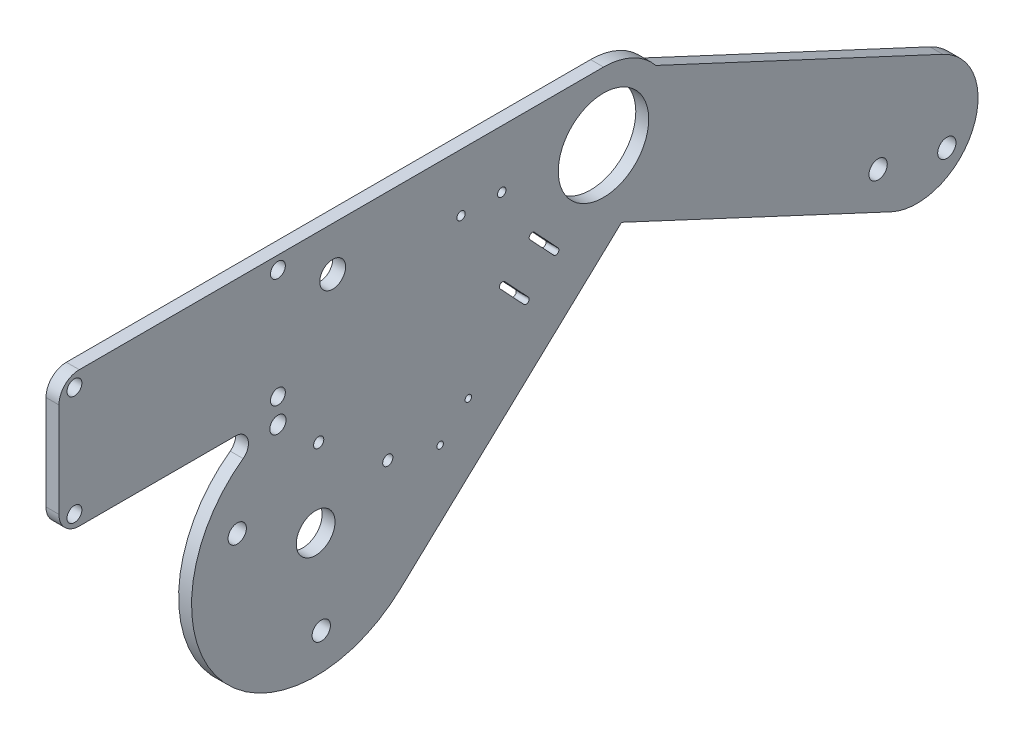
from build123d import *

# Parameters (mm, degrees)
SKETCH1_R                  = 4.7625
SKETCH1_R_2                = 11.1125
BOSS_EXTRUDE1_DEPTH        = 1.5875
SKETCH12_R                 = 11.1125
BOSS_EXTRUDE2_DEPTH        = 1.5875
F_6_CLEARANCE_HOLE1_D      = 3.6576
M3X0_5_TAPPED_HOLE1_D      = 2.5
M4_CLEARANCE_HOLE1_D       = 4.5
M2X0_4_TAPPED_HOLE1_D      = 1.6
FILLET1_R                  = 5
FILLET2_R                  = 3.175
CUT_EXTRUDE1_DEPTH         = 155.713872435
CUT_EXTRUDE1_DEPTH_BACK    = 155.713872435
SKETCH1_3_R                = 2
F_1_4_0_2500_DOWEL_HOLE1_D = 6.35
F_1_5MM_START              = -1.5875
F_1_5MM_DOWEL_SLOT1_DEPTH  = 3.175
M2_5X0_45_TAPPED_HOLE1_D   = 2.05


# Read off the part's stored shape, not the designer's step: Ø1.5mm Dowel Slot1
with BuildPart() as part:
    # Sketch1 → Boss-Extrude1 (new, symmetric)
    with BuildSketch(Plane(origin=(0, 0, 0), x_dir=(0, 0, -1), z_dir=(1, 0, 0))):
        with BuildLine():
            ThreePointArc((-83.281063832, -19.348369622), (-96.105900293, -64.061735294), (-49.900079745, -69.426774672))
            Line((-49.900079745, -69.426774672), (11.366191703, -12.160004571))
            ThreePointArc((11.366191703, -12.160004571), (15.483205435, 6.109531443), (0, 16.645))
            Line((0, 16.645), (-133.81, 16.645))
            Line((-133.81, 16.645), (-133.81, -16.645))
            Line((-133.81, -16.645), (-77.295250897, -16.645))
            Line((-77.295250897, -16.645), (-83.281063832, -19.348369622))
        make_face()
        with Locations((-70.72728593, -47.145)):
            Circle(SKETCH1_R, mode=Mode.SUBTRACT)
        Circle(SKETCH1_R_2, mode=Mode.SUBTRACT)
    extrude(amount=BOSS_EXTRUDE1_DEPTH, both=True)

    # Sketch12 → Boss-Extrude2 (add, symmetric)
    with BuildSketch(Plane(origin=(0, 0, 0), x_dir=(0, 0, -1), z_dir=(1, 0, 0))):
        with BuildLine():
            Line((83.375435824, -22.327935442), (6.339273926, 13.594616806))
            ThreePointArc((6.339273926, 13.594616806), (-13.594616806, 6.339273926), (-6.339273926, -13.594616806))
            Line((-6.339273926, -13.594616806), (70.696887972, -49.517169054))
            ThreePointArc((70.696887972, -49.517169054), (90.630778704, -42.261826174), (83.375435824, -22.327935442))
        make_face()
        Circle(SKETCH12_R, mode=Mode.SUBTRACT)
    extrude(amount=BOSS_EXTRUDE2_DEPTH, both=True)

    # #6 Clearance Hole1 (through all)
    with Locations(Plane(origin=(1.5875, 0, 0), x_dir=(0, 0, -1), z_dir=(1, 0, 0))):
        with Locations((-80, -13.475), (-80, 13.475), (-130, 13.475), (-130, -13.475)):
            Hole(F_6_CLEARANCE_HOLE1_D / 2)

    # M3x0.5 Tapped Hole1 (through all)
    with Locations(Plane(origin=(1.5875, 0, 0), x_dir=(0, 0, -1), z_dir=(1, 0, 0))):
        with Locations((-53.003557214, -40.529688942), (-69.983650742, -28.241563627)):
            Hole(M3X0_5_TAPPED_HOLE1_D / 2)

    # M4 Clearance Hole1 (through all)
    with Locations(Plane(origin=(1.5875, 0, 0), x_dir=(0, 0, -1), z_dir=(1, 0, 0))):
        with Locations((84.362778856, -42.728482305), (-69.34493086, -68.600514314), (-89.999483912, -37.614397451), (67.478745093, -38.864623629)):
            Hole(M4_CLEARANCE_HOLE1_D / 2)

    # M2x0.4 Tapped Hole1 (through all)
    with Locations(Plane(origin=(1.5875, 0, 0), x_dir=(0, 0, -1), z_dir=(1, 0, 0))):
        with Locations((-33.212044815, -37.265281486), (-40.152269713, -43.752444068)):
            Hole(M2X0_4_TAPPED_HOLE1_D / 2)

    # Fillet1
    fillet1_edges = [part.edges().sort_by_distance(p)[0] for p in [
        (0, -16.645, 133.81),
        (0, 16.645, 133.81),
    ]]
    fillet(fillet1_edges, radius=FILLET1_R)

    # Fillet2
    fillet2_edges = [part.edges().sort_by_distance(p)[0] for p in [
        (0, -16.645, 77.295250897),
    ]]
    fillet(fillet2_edges, radius=FILLET2_R)

    # Sketch1<3> → Cut-Extrude1 (cut, two sides: drawn at the far end of the back side and taken through both)
    with BuildSketch(Plane(origin=(0, 0, 0), x_dir=(0, 0, -1), z_dir=(1, 0, 0)).offset(-CUT_EXTRUDE1_DEPTH_BACK)):
        with Locations((-80, -19.435)):
            Circle(SKETCH1_3_R)
    extrude(amount=CUT_EXTRUDE1_DEPTH + CUT_EXTRUDE1_DEPTH_BACK, mode=Mode.SUBTRACT)

    # 1/4 (0.2500) Dowel Hole1 (through all)
    with Locations(Plane(origin=(1.5875, 0, 0), x_dir=(0, 0, -1), z_dir=(1, 0, 0))):
        with Locations((-66.545805833, 5.822003616)):
            Hole(F_1_4_0_2500_DOWEL_HOLE1_D / 2)

    # Ø1.5mm Dowel Slot1 outline → Ø1.5mm Dowel Slot1 (cut)
    with BuildSketch(Plane.YZ.offset(F_1_5MM_START)):
        with BuildLine():
            Line((-16.249877423, 11.160935612), (-10.040202515, 16.965238975))
            ThreePointArc((-10.040202515, 16.965238975), (-10.004434437, 18.025295881), (-11.064491343, 18.061063959))
            Line((-11.064491343, 18.061063959), (-17.274166252, 12.256760596))
            ThreePointArc((-17.274166252, 12.256760596), (-17.30993433, 11.196703689), (-16.249877423, 11.160935612))
        make_face()
        with BuildLine():
            Line((-23.078469615, 18.466435504), (-16.868794706, 24.270738867))
            ThreePointArc((-16.868794706, 24.270738867), (-16.833026629, 25.330795773), (-17.893083535, 25.366563851))
            Line((-17.893083535, 25.366563851), (-24.102758444, 19.562260488))
            ThreePointArc((-24.102758444, 19.562260488), (-24.138526521, 18.502203582), (-23.078469615, 18.466435504))
        make_face()
    extrude(amount=F_1_5MM_DOWEL_SLOT1_DEPTH, mode=Mode.SUBTRACT)

    # M2.5x0.45 Tapped Hole1 (through all)
    with Locations(Plane(origin=(1.5875, 0, 0), x_dir=(0, 0, -1), z_dir=(1, 0, 0))):
        with Locations((-35, 2.5), (-25, 2.5)):
            Hole(M2_5X0_45_TAPPED_HOLE1_D / 2)


solid = part.part
